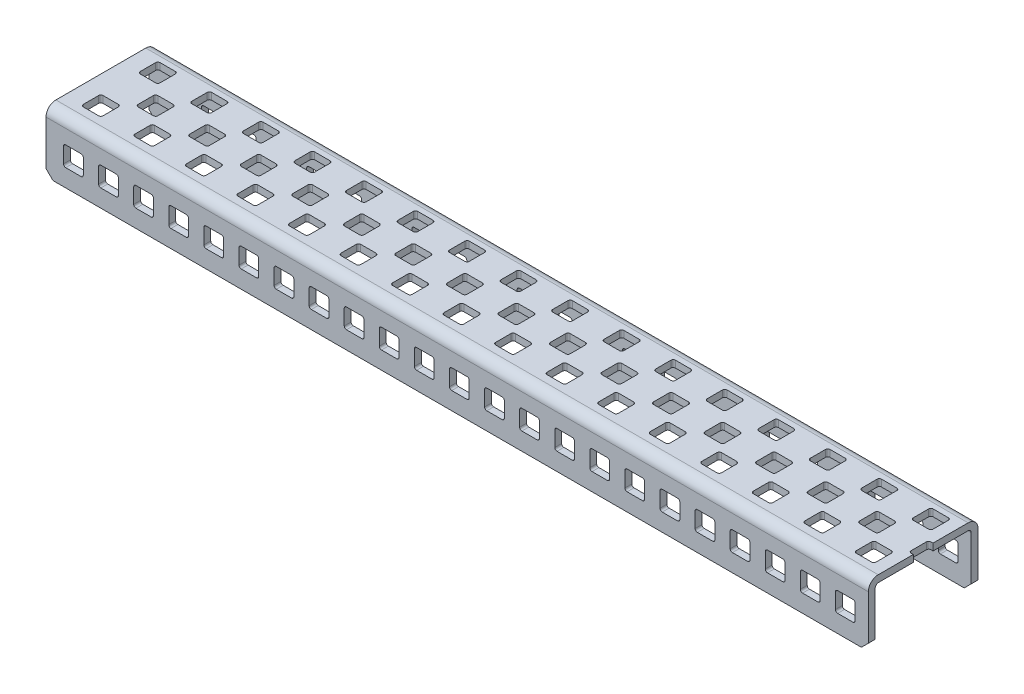
from build123d import *

# Parameters (mm, degrees)
BOSS_EXTRUDE2_DEPTH  = 190.5
CUT_EXTRUDE1_DEPTH   = 193.7115258
LPATTERN1_COUNT      = 39
LPATTERN1_PITCH      = 8.128
CUT_EXTRUDE2_DEPTH   = 193.7115258
CUT_EXTRUDE3_DEPTH   = 193.7115258
CUT_EXTRUDE4_DEPTH   = 193.7115258
LPATTERN2_COUNT      = 2
LPATTERN2_PITCH      = 13.208
LPATTERN2_COUNT_DIR2 = 27
LPATTERN2_PITCH_DIR2 = 11.938
CUT_EXTRUDE5_DEPTH   = 193.7115258
LPATTERN3_COUNT      = 26
LPATTERN3_PITCH      = 11.938


with BuildPart() as part:
    # Sketch1 → Boss-Extrude2 (new body)
    with BuildSketch(Plane(origin=(0, 0, 0), x_dir=(0, 0, -1), z_dir=(1, 0, 0))):
        with BuildLine():
            Line((0, 0), (0, 11.938))
            ThreePointArc((0, 11.938), (0.669553898, 13.554446102), (2.286, 14.224))
            Line((2.286, 14.224), (23.114, 14.224))
            ThreePointArc((23.114, 14.224), (24.730446102, 13.554446102), (25.4, 11.938))
            Line((25.4, 11.938), (25.4, 0))
            Line((25.4, 0), (23.8125, 0))
            Line((23.8125, 0), (23.8125, 11.8745))
            ThreePointArc((23.8125, 11.8745), (23.589315367, 12.413315367), (23.0505, 12.6365))
            Line((23.0505, 12.6365), (2.3495, 12.6365))
            ThreePointArc((2.3495, 12.6365), (1.810684633, 12.413315367), (1.5875, 11.8745))
            Line((1.5875, 11.8745), (1.5875, 0))
            Line((1.5875, 0), (0, 0))
        make_face()
    extrude(amount=BOSS_EXTRUDE2_DEPTH)

    # Sketch2 → Cut-Extrude1 (cut, through all)
    with BuildSketch(Plane.XY):
        with BuildLine():
            Line((4.572, 8.636), (8.128, 8.636))
            ThreePointArc((8.128, 8.636), (8.487210245, 8.487210245), (8.636, 8.128))
            Line((8.636, 8.128), (8.636, 4.572))
            ThreePointArc((8.636, 4.572), (8.487210245, 4.212789755), (8.128, 4.064))
            Line((8.128, 4.064), (4.572, 4.064))
            ThreePointArc((4.572, 4.064), (4.212789755, 4.212789755), (4.064, 4.572))
            Line((4.064, 4.572), (4.064, 8.128))
            ThreePointArc((4.064, 8.128), (4.212789755, 8.487210245), (4.572, 8.636))
        make_face()
    cut_extrude1 = extrude(amount=-CUT_EXTRUDE1_DEPTH, mode=Mode.SUBTRACT)

    # LPattern1: Cut-Extrude1 ×39
    with Locations(*[(i * LPATTERN1_PITCH, 0, 0) for i in range(1, LPATTERN1_COUNT)]):
        add(cut_extrude1, mode=Mode.SUBTRACT)

    # Sketch3 → Cut-Extrude2 (cut, through all)
    with BuildSketch(Plane.XY):
        Polygon((0, 1.616446102), (1.616446102, 0), (0, 0), align=None)
    extrude(amount=-CUT_EXTRUDE2_DEPTH, mode=Mode.SUBTRACT)

    # Sketch4 → Cut-Extrude3 (cut, through all)
    with BuildSketch(Plane.XY):
        Polygon((188.883553898, 0), (190.5, 1.616446102), (190.5, 0), align=None)
    extrude(amount=-CUT_EXTRUDE3_DEPTH, mode=Mode.SUBTRACT)

    # Sketch5 → Cut-Extrude4 (cut, through all)
    with BuildSketch(Plane(origin=(0, 14.224, 0), x_dir=(1, 0, 0), z_dir=(0, 1, 0))):
        with BuildLine():
            Line((4.572, 4.064), (8.128, 4.064))
            ThreePointArc((8.128, 4.064), (8.487210245, 4.212789755), (8.636, 4.572))
            Line((8.636, 4.572), (8.636, 8.128))
            ThreePointArc((8.636, 8.128), (8.487210245, 8.487210245), (8.128, 8.636))
            Line((8.128, 8.636), (4.572, 8.636))
            ThreePointArc((4.572, 8.636), (4.212789755, 8.487210245), (4.064, 8.128))
            Line((4.064, 8.128), (4.064, 4.572))
            ThreePointArc((4.064, 4.572), (4.212789755, 4.212789755), (4.572, 4.064))
        make_face()
    cut_extrude4 = extrude(amount=-CUT_EXTRUDE4_DEPTH, mode=Mode.SUBTRACT)

    # LPattern2: Cut-Extrude4 2 × 27
    with Locations(*[(j * LPATTERN2_PITCH_DIR2, 0, -i * LPATTERN2_PITCH) for i in range(LPATTERN2_COUNT) for j in range(LPATTERN2_COUNT_DIR2) if (i, j) != (0, 0)]):
        add(cut_extrude4, mode=Mode.SUBTRACT)

    # Sketch6 → Cut-Extrude5 (cut, through all)
    with BuildSketch(Plane(origin=(0, 14.224, 0), x_dir=(1, 0, 0), z_dir=(0, 1, 0))):
        with BuildLine():
            Line((10.922, 14.986), (14.478, 14.986))
            ThreePointArc((14.478, 14.986), (14.837210245, 14.837210245), (14.986, 14.478))
            Line((14.986, 14.478), (14.986, 10.922))
            ThreePointArc((14.986, 10.922), (14.837210245, 10.562789755), (14.478, 10.414))
            Line((14.478, 10.414), (10.922, 10.414))
            ThreePointArc((10.922, 10.414), (10.562789755, 10.562789755), (10.414, 10.922))
            Line((10.414, 10.922), (10.414, 14.478))
            ThreePointArc((10.414, 14.478), (10.562789755, 14.837210245), (10.922, 14.986))
        make_face()
    cut_extrude5 = extrude(amount=-CUT_EXTRUDE5_DEPTH, mode=Mode.SUBTRACT)

    # LPattern3: Cut-Extrude5 ×26
    with Locations(*[(i * LPATTERN3_PITCH, 0, 0) for i in range(1, LPATTERN3_COUNT)]):
        add(cut_extrude5, mode=Mode.SUBTRACT)


solid = part.part
